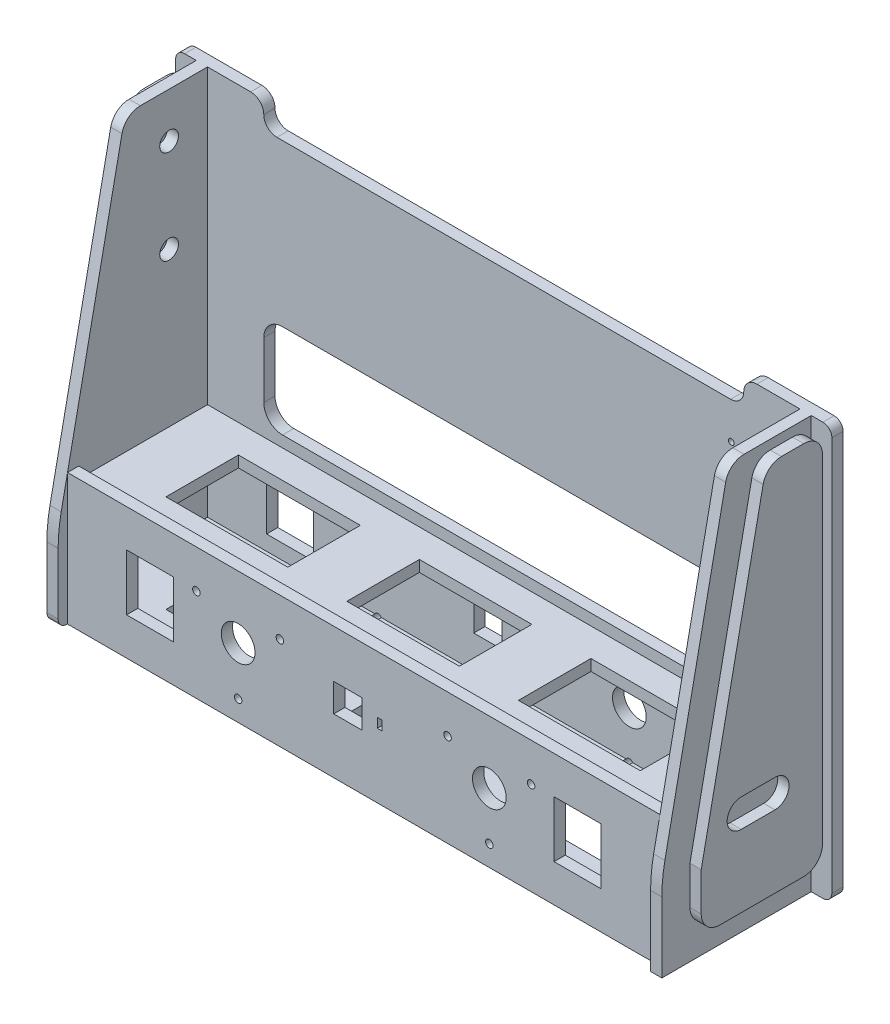
from build123d import *

# Parameters (mm, degrees)
EXTRUDE_1_DEPTH      = 340
SKETCH_2_W           = 316
SKETCH_2_H           = 89
CUT_EXTRUDE_1_DEPTH  = 150
SKETCH_3_W           = 316
SKETCH_3_H           = 14.318181818
CUT_EXTRUDE_2_DEPTH  = 384.56876828
CUT_EXTRUDE_START    = -6
SKETCH_4_W           = 316
SKETCH_4_H           = 46
SKETCH_4_H_2         = 6
CUT_EXTRUDE_3_DEPTH  = 68.681818182
SKETCH_5_W           = 256
SKETCH_5_H           = 50
CUT_EXTRUDE_4_DEPTH  = 415.63357317
SKETCH_6_W           = 60
SKETCH_6_H           = 38.681818182
SKETCH_6_W_2         = 65
CUT_EXTRUDE_5_DEPTH  = 384.56876828
SKETCH_8_W           = 9.318181818
SKETCH_8_H           = 70
CUT_EXTRUDE_7_DEPTH  = 416.962738716
SKETCH_10_W          = 5
SKETCH_10_H          = 6
EXTRUDE_3_DEPTH      = 220
SKETCH_12_R          = 5
CUT_EXTRUDE_9_DEPTH  = 328
SKETCH_13_R          = 16.4
SKETCH_13_R_2        = 1.5
CUT_EXTRUDE_10_DEPTH = 417.862317977
FILLET_2_R           = 10
FILLET_4_R           = 80
SKETCH_16_R          = 9
CUT_EXTRUDE_12_DEPTH = 418.054619666
SKETCH_19_R          = 2
SKETCH_19_W          = 15
SKETCH_19_H          = 15
SKETCH_19_W_2        = 2.5
SKETCH_19_H_2        = 5
CUT_EXTRUDE_15_DEPTH = 418.054619666
FILLET_5_R           = 4.8
FILLET_6_R           = 10
CUT_EXTRUDE_16_DEPTH = 417.862317977
SKETCH_21_W          = 256
SKETCH_21_H          = 14
CUT_EXTRUDE_17_DEPTH = 417.862317977
FILLET_7_R           = 7
CUT_EXTRUDE_18_DEPTH = 6
SKETCH_23_W          = 25
SKETCH_23_H          = 30
CUT_EXTRUDE_19_DEPTH = 418.054619666


with BuildPart() as part:
    # Эскиз1 → Бобышка-Вытянуть1 (new body)
    with BuildSketch(Plane(origin=(0, 0, 0), x_dir=(0, 0, -1), z_dir=(1, 0, 0))):
        Polygon((0, 220), (0, 0), (-95, 0), (-50, 220), align=None)
    extrude(amount=EXTRUDE_1_DEPTH)

    # Эскиз2 → Вырез-Вытянуть1 (cut)
    with BuildSketch(Plane(origin=(0, 220, 0), x_dir=(1, 0, 0), z_dir=(0, 1, 0))):
        with Locations((170, -50.5)):
            Rectangle(SKETCH_2_W, SKETCH_2_H)
    extrude(amount=-CUT_EXTRUDE_1_DEPTH, mode=Mode.SUBTRACT)

    # Эскиз3 → Вырез-Вытянуть2 (cut, through all)
    with BuildSketch(Plane(origin=(0, 70, 0), x_dir=(1, 0, 0), z_dir=(0, 1, 0))):
        with Locations((170, -87.840909091)):
            Rectangle(SKETCH_3_W, SKETCH_3_H)
    extrude(amount=-CUT_EXTRUDE_2_DEPTH, mode=Mode.SUBTRACT)

    # Эскиз4 → Вырез-Вытянуть3 (cut)
    with BuildSketch(Plane.XY.offset(80.681818182).offset(CUT_EXTRUDE_START)):
        with Locations((170, 35)):
            Rectangle(SKETCH_4_W, SKETCH_4_H)
        with Locations((170, 67)):
            Rectangle(SKETCH_4_W, SKETCH_4_H_2)
        with Locations((170, 3)):
            Rectangle(SKETCH_4_W, SKETCH_4_H_2)
    extrude(amount=-CUT_EXTRUDE_3_DEPTH, mode=Mode.SUBTRACT)

    # Эскиз5 → Вырез-Вытянуть4 (cut, through all)
    with BuildSketch(Plane.XY.offset(6)):
        with Locations((170, 95)):
            Rectangle(SKETCH_5_W, SKETCH_5_H)
    extrude(amount=-CUT_EXTRUDE_4_DEPTH, mode=Mode.SUBTRACT)

    # Эскиз6 → Вырез-Вытянуть5 (cut, through all)
    with BuildSketch(Plane(origin=(0, 70, 0), x_dir=(1, 0, 0), z_dir=(0, 1, 0))):
        with Locations((170, -40.340909091)):
            Rectangle(SKETCH_6_W, SKETCH_6_H)
        with Locations((76, -40.340909091)):
            Rectangle(SKETCH_6_W_2, SKETCH_6_H)
        with Locations((264, -40.340909091)):
            Rectangle(SKETCH_6_W_2, SKETCH_6_H)
    extrude(amount=-CUT_EXTRUDE_5_DEPTH, mode=Mode.SUBTRACT)

    # Эскиз8 → Вырез-Вытянуть7 (cut, through all)
    with BuildSketch(Plane.ZY):
        with Locations((90.340909091, 35)):
            Rectangle(SKETCH_8_W, SKETCH_8_H)
    extrude(amount=-CUT_EXTRUDE_7_DEPTH, mode=Mode.SUBTRACT)

    # Эскиз10 → Бобышка-Вытянуть3 (add)
    with BuildSketch(Plane(origin=(0, 220, 0), x_dir=(1, 0, 0), z_dir=(0, 1, 0))):
        with Locations((-2.5, -3)):
            Rectangle(SKETCH_10_W, SKETCH_10_H)
        with Locations((342.5, -3)):
            Rectangle(SKETCH_10_W, SKETCH_10_H)
    extrude(amount=-EXTRUDE_3_DEPTH)

    # Эскиз12 → Вырез-Вытянуть9 (cut)
    with BuildSketch(Plane.ZY.offset(CUT_EXTRUDE_START)):
        with Locations((26.5, 196)):
            Circle(SKETCH_12_R)
        with Locations((26.5, 146)):
            Circle(SKETCH_12_R)
    extrude(amount=-CUT_EXTRUDE_9_DEPTH, mode=Mode.SUBTRACT)

    # Эскиз13 → Вырез-Вытянуть10 (cut, through all)
    with BuildSketch(Plane.XY.offset(6)):
        with Locations((306.85, 171)):
            Circle(SKETCH_13_R)
        with Locations((291.35, 186.5)):
            Circle(SKETCH_13_R_2)
        with Locations((322.35, 186.5)):
            Circle(SKETCH_13_R_2)
        with Locations((322.35, 155.5)):
            Circle(SKETCH_13_R_2)
        with Locations((291.35, 155.5)):
            Circle(SKETCH_13_R_2)
    extrude(amount=-CUT_EXTRUDE_10_DEPTH, mode=Mode.SUBTRACT)

    # Скругление2
    fillet_2_edges = [part.edges().sort_by_distance(p)[0] for p in [
        (6, 220, 50),
        (334, 220, 50),
    ]]
    fillet(fillet_2_edges, radius=FILLET_2_R)

    # Скругление4
    fillet_4_edges = [part.edges().sort_by_distance(p)[0] for p in [
        (6, 45.555555556, 85.681818182),
        (334, 45.555555556, 85.681818182),
    ]]
    fillet(fillet_4_edges, radius=FILLET_4_R)

    # Эскиз16 → Вырез-Вытянуть12 (cut, through all)
    with BuildSketch(Plane.XY.offset(80.681818182)):
        with Locations((103, 36.723805295)):
            Circle(SKETCH_16_R)
        with Locations((237, 36.723805295)):
            Circle(SKETCH_16_R)
    extrude(amount=-CUT_EXTRUDE_12_DEPTH, mode=Mode.SUBTRACT)

    # Эскиз19 → Вырез-Вытянуть15 (cut, through all)
    with BuildSketch(Plane.XY.offset(80.681818182)):
        with Locations((125.277468867, 49.585707942)):
            Circle(SKETCH_19_R)
        with Locations((80.722531133, 49.585707942)):
            Circle(SKETCH_19_R)
        with Locations((103, 11)):
            Circle(SKETCH_19_R)
        with Locations((214.722531133, 49.585707942)):
            Circle(SKETCH_19_R)
        with Locations((259.277468867, 49.585707942)):
            Circle(SKETCH_19_R)
        with Locations((237, 11)):
            Circle(SKETCH_19_R)
        with Locations((161.5, 37)):
            Rectangle(SKETCH_19_W, SKETCH_19_H)
        with Locations((178.5, 37)):
            Rectangle(SKETCH_19_W_2, SKETCH_19_H_2)
    extrude(amount=-CUT_EXTRUDE_15_DEPTH, mode=Mode.SUBTRACT)

    # Скругление5
    fillet_5_edges = [part.edges().sort_by_distance(p)[0] for p in [
        (-5, 0, 3),
        (-5, 220, 3),
        (6, 0, 85.681818182),
        (345, 0, 3),
        (345, 220, 3),
    ]]
    fillet(fillet_5_edges, radius=FILLET_5_R)

    # Скругление6
    fillet_6_edges = [part.edges().sort_by_distance(p)[0] for p in [
        (42, 70, 3),
        (42, 120, 3),
        (298, 120, 3),
        (298, 70, 3),
    ]]
    fillet(fillet_6_edges, radius=FILLET_6_R)

    # Эскиз20 → Вырез-Вытянуть16 (cut, through all)
    with BuildSketch(Plane.XY.offset(6)):
        with BuildLine():
            Line((319.514215804, 124.1), (309.514215804, 124.1))
            ThreePointArc((309.514215804, 124.1), (309.014215804, 124.6), (309.514215804, 125.1))
            Line((309.514215804, 125.1), (319.514215804, 125.1))
            ThreePointArc((319.514215804, 125.1), (320.014215804, 124.6), (319.514215804, 124.1))
        make_face()
        with BuildLine():
            Line((319.514215804, 114.6), (309.514215804, 114.6))
            ThreePointArc((309.514215804, 114.6), (309.014215804, 115.1), (309.514215804, 115.6))
            Line((309.514215804, 115.6), (319.514215804, 115.6))
            ThreePointArc((319.514215804, 115.6), (320.014215804, 115.1), (319.514215804, 114.6))
        make_face()
    extrude(amount=-CUT_EXTRUDE_16_DEPTH, mode=Mode.SUBTRACT)

    # Эскиз21 → Вырез-Вытянуть17 (cut, through all)
    with BuildSketch(Plane.XY.offset(6)):
        with Locations((170, 213)):
            Rectangle(SKETCH_21_W, SKETCH_21_H)
    extrude(amount=-CUT_EXTRUDE_17_DEPTH, mode=Mode.SUBTRACT)

    # Скругление7
    fillet_7_edges = [part.edges().sort_by_distance(p)[0] for p in [
        (42, 206, 3),
        (298, 206, 3),
    ]]
    fillet(fillet_7_edges, radius=FILLET_7_R)
    fillet_7_2_edges = [part.edges().sort_by_distance(p)[0] for p in [
        (42, 220, 3),
        (298, 220, 3),
    ]]
    fillet(fillet_7_2_edges, radius=FILLET_7_R - 0.0001)  # a hair under: the kernel refuses the full size

    # Эскиз22 → Вырез-Вытянуть18 (cut)
    with BuildSketch(Plane.ZY):
        with BuildLine():
            Line((16, 215), (27.861131103, 215))
            ThreePointArc((27.861131103, 215), (34.184119969, 212.747245434), (37.658280426, 207.003962361))
            Line((37.658280426, 207.003962361), (70.681818182, 45.555555556))
            Line((70.681818182, 45.555555556), (70.681818182, 25))
            ThreePointArc((70.681818182, 25), (67.752885994, 17.928932188), (60.681818182, 15))
            Line((60.681818182, 15), (16, 15))
            ThreePointArc((16, 15), (8.928932188, 17.928932188), (6, 25))
            Line((6, 25), (6, 0))
            Line((6, 0), (85.681818182, 0))
            Line((85.681818182, 0), (85.681818182, 45.555555556))
            Line((85.681818182, 45.555555556), (50, 220))
            Line((50, 220), (6, 220))
            Line((6, 220), (6, 205))
            ThreePointArc((6, 205), (8.928932188, 212.071067812), (16, 215))
        make_face()
        with BuildLine():
            Line((49.340909091, 53.5), (31.340909091, 53.5))
            ThreePointArc((31.340909091, 53.5), (23.840909091, 61), (31.340909091, 68.5))
            Line((31.340909091, 68.5), (49.340909091, 68.5))
            ThreePointArc((49.340909091, 68.5), (56.840909091, 61), (49.340909091, 53.5))
        make_face()
    cut_extrude_18 = extrude(amount=-CUT_EXTRUDE_18_DEPTH, mode=Mode.SUBTRACT)

    # Зеркальное отражение1: Вырез-Вытянуть18 across plane
    add(cut_extrude_18.mirror(Plane.ZY.offset(-170)), mode=Mode.SUBTRACT)

    # Эскиз23 → Вырез-Вытянуть19 (cut, through all)
    with BuildSketch(Plane.XY.offset(80.681818182)):
        with Locations((56, 35)):
            Rectangle(SKETCH_23_W, SKETCH_23_H)
        with Locations((284, 35)):
            Rectangle(SKETCH_23_W, SKETCH_23_H)
    extrude(amount=-CUT_EXTRUDE_19_DEPTH, mode=Mode.SUBTRACT)


solid = part.part
